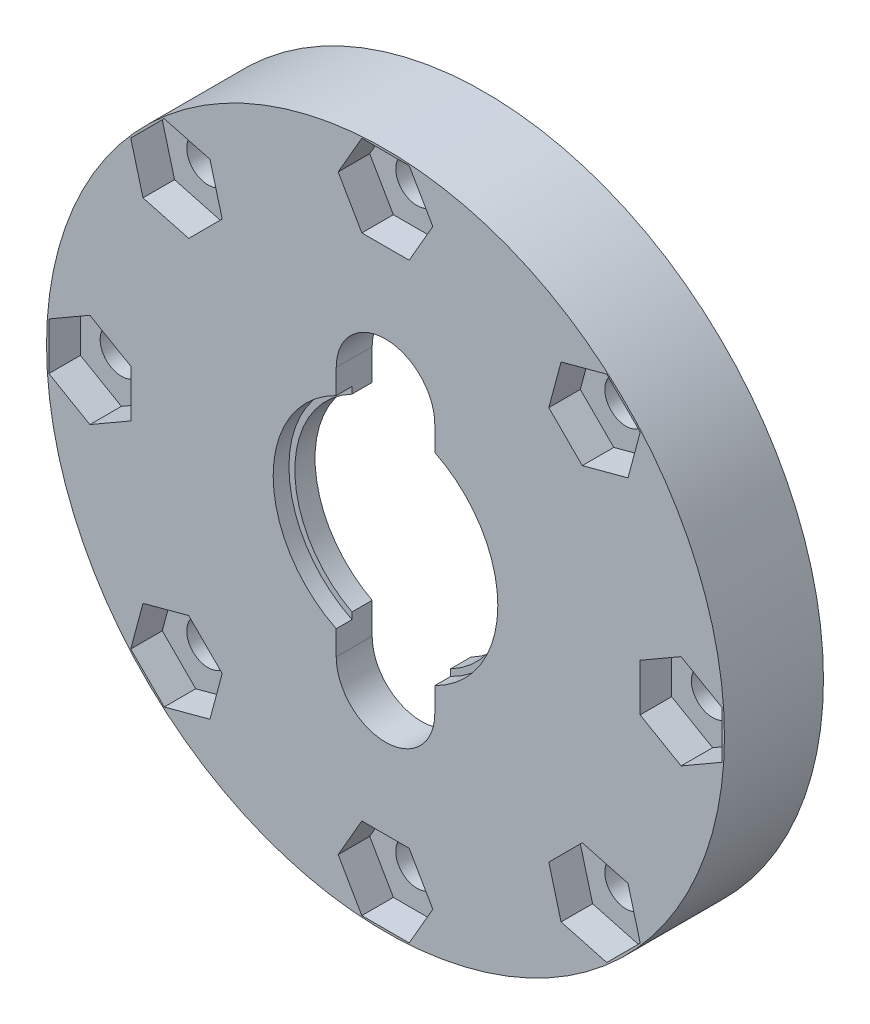
from build123d import *

# Parameters (mm, degrees)
SKETCH3_R           = 21.5
BOSS_EXTRUDE2_DEPTH = 1
SKETCH4_R           = 21.5
BOSS_EXTRUDE3_DEPTH = 5.28
SKETCH5_R           = 17.25
CUT_EXTRUDE1_DEPTH  = 4
CUT_EXTRUDE2_DEPTH  = 2
SKETCH8_R           = 1.35
CUT_EXTRUDE4_DEPTH  = 32.047357375
CIRPATTERN1_COUNT   = 8
CUT_EXTRUDE5_DEPTH  = 32.047357375


with BuildPart() as part:
    # Sketch3 → Boss-Extrude2 (new body)
    with BuildSketch(Plane.XY):
        Circle(SKETCH3_R)
        with BuildLine():
            Line((-3.124988, -6.403130094), (-3.124988, -7.949679))
            Line((-3.124988, -7.949679), (3.125012, -7.949679))
            Line((3.125012, -7.949679), (3.125012, -6.403118381))
            ThreePointArc((3.125012, -6.403118381), (7.125, 0), (3.125012, 6.403118381))
            Line((3.125012, 6.403118381), (3.125012, 7.949431))
            Line((3.125012, 7.949431), (-3.124988, 7.949431))
            Line((-3.124988, 7.949431), (-3.124988, 6.403130094))
            ThreePointArc((-3.124988, 6.403130094), (-7.125, 0), (-3.124988, -6.403130094))
        make_face(mode=Mode.SUBTRACT)
    extrude(amount=-BOSS_EXTRUDE2_DEPTH)

    # Sketch4 → Boss-Extrude3 (add)
    with BuildSketch(Plane(origin=(0, 0, -1), x_dir=(-1, 0, 0), z_dir=(0, 0, -1))):
        Circle(SKETCH4_R)
        with BuildLine():
            Line((2.749988, 6.164419356), (2.749988, 7.574431))
            Line((2.749988, 7.574431), (-2.750012, 7.574431))
            Line((-2.750012, 7.574431), (-2.750012, 6.16440865))
            ThreePointArc((-2.750012, 6.16440865), (-6.75, 0), (-2.750012, -6.16440865))
            Line((-2.750012, -6.16440865), (-2.750012, -7.574679))
            Line((-2.750012, -7.574679), (2.749988, -7.574679))
            Line((2.749988, -7.574679), (2.749988, -6.164419356))
            ThreePointArc((2.749988, -6.164419356), (6.75, 0), (2.749988, 6.164419356))
        make_face(mode=Mode.SUBTRACT)
    extrude(amount=BOSS_EXTRUDE3_DEPTH)

    # Sketch5 → Cut-Extrude1 (cut)
    with BuildSketch(Plane(origin=(0, 0, -6.28), x_dir=(-1, 0, 0), z_dir=(0, 0, -1))):
        Circle(SKETCH5_R)
    extrude(amount=-CUT_EXTRUDE1_DEPTH, mode=Mode.SUBTRACT)

    # Sketch6 → Cut-Extrude2 (cut)
    with BuildSketch(Plane.XY):
        Polygon((-21.35, -1.5011107), (-18.75, -3.0022214), (-16.15, -1.5011107), (-16.15, 1.5011107), (-18.75, 3.0022214), (-21.35, 1.5011107), align=None)
    cut_extrude2 = extrude(amount=-CUT_EXTRUDE2_DEPTH, mode=Mode.SUBTRACT)

    # Sketch8 → Cut-Extrude4 (cut, through all)
    with BuildSketch(Plane.XY):
        with Locations((-18.75, 0)):
            Circle(SKETCH8_R)
    cut_extrude4 = extrude(amount=-CUT_EXTRUDE4_DEPTH, mode=Mode.SUBTRACT)

    # CirPattern1: Cut-Extrude2, Cut-Extrude4 ×8 about axis
    cirpattern1_axis = Axis((0, 0, -6.594), (0, 0, 1))
    add([cut_extrude2.rotate(cirpattern1_axis, i * 360 / CIRPATTERN1_COUNT) for i in range(1, CIRPATTERN1_COUNT)], mode=Mode.SUBTRACT)
    add([cut_extrude4.rotate(cirpattern1_axis, i * 360 / CIRPATTERN1_COUNT) for i in range(1, CIRPATTERN1_COUNT)], mode=Mode.SUBTRACT)

    # Sketch9 → Cut-Extrude5 (cut, through all)
    with BuildSketch(Plane.XY):
        with BuildLine():
            Line((3.125012, 7.949431), (3.125012, -7.949431))
            ThreePointArc((3.125012, -7.949431), (1.2e-05, -11.074431), (-3.124988, -7.949431))
            Line((-3.124988, -7.949431), (-3.124988, 7.949431))
            ThreePointArc((-3.124988, 7.949431), (1.2e-05, 11.074431), (3.125012, 7.949431))
        make_face()
    extrude(amount=-CUT_EXTRUDE5_DEPTH, mode=Mode.SUBTRACT)


solid = part.part
